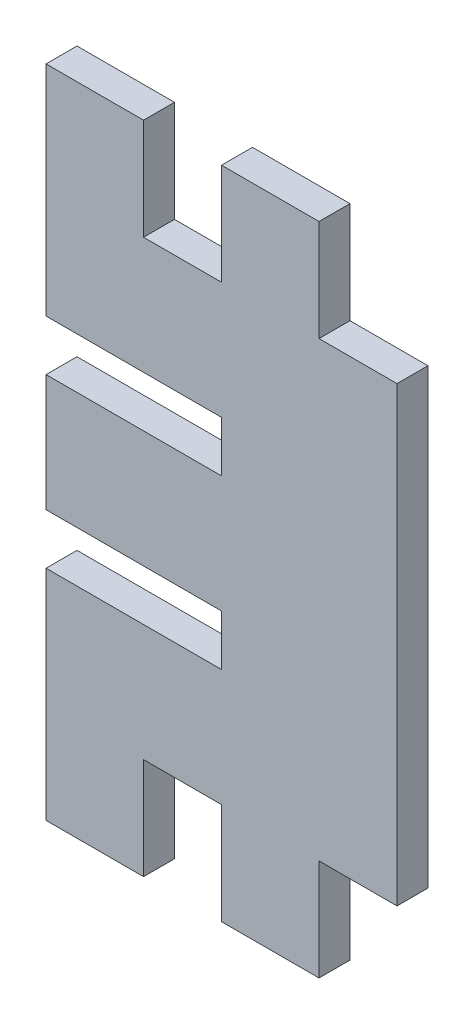
from build123d import *

# Parameters (mm, degrees)
BOSS_EXTRUDE2_DEPTH = 3.175


with BuildPart() as part:
    # Sketch1 → Boss-Extrude2 (new body)
    with BuildSketch(Plane.XY):
        Polygon((-18, 6), (-18, -6), (0, -6), (0, -11.2), (-18, -11.2), (-18, -33.6), (-8, -33.6), (-8, -23.2), (0, -23.2), (0, -33.6), (10, -33.6), (10, -23.2), (18, -23.2), (18, 23.2), (10, 23.2), (10, 33.6), (0, 33.6), (0, 23.2), (-8, 23.2), (-8, 33.6), (-18, 33.6), (-18, 11.2), (0, 11.2), (0, 6), align=None)
    extrude(amount=BOSS_EXTRUDE2_DEPTH)


solid = part.part
